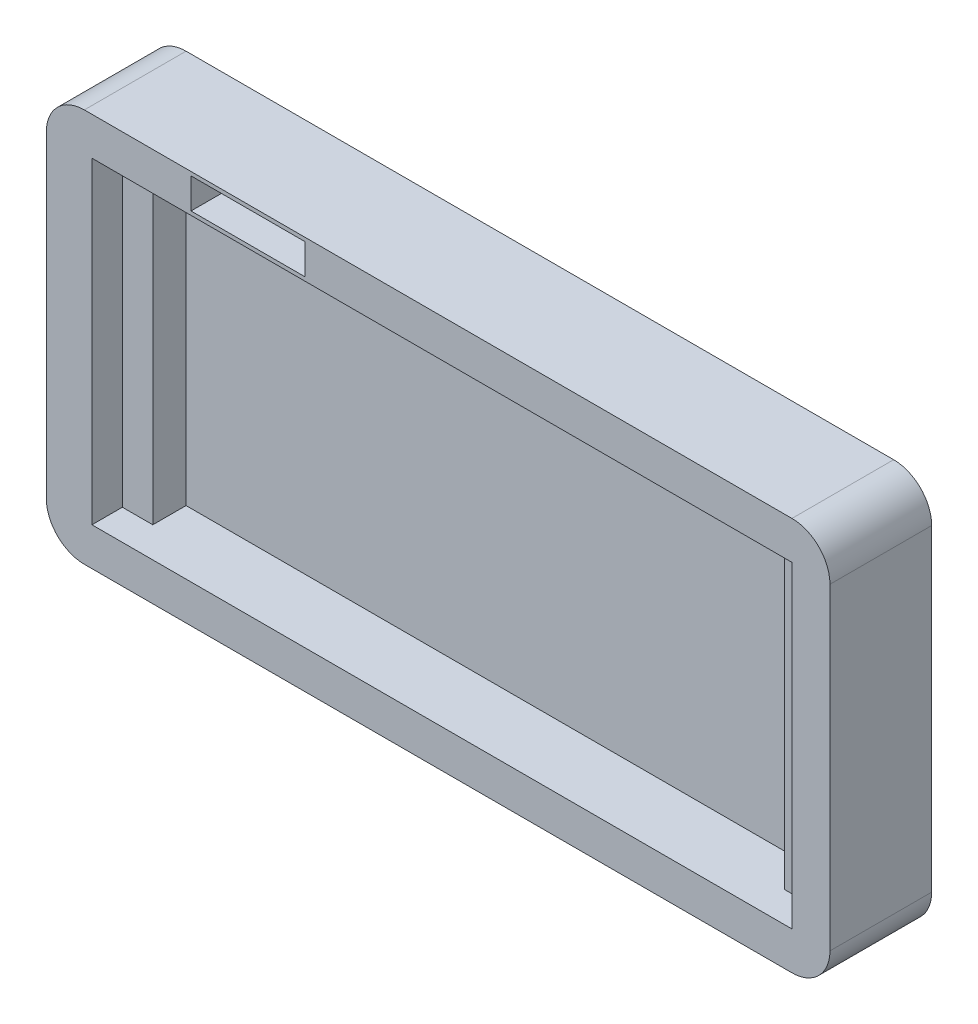
from build123d import *

# Parameters (mm, degrees)
CROQUIS1_W              = 37.22
CROQUIS1_H              = 16.7
SALIENTE_EXTRUIR1_DEPTH = 3.35
VACIADO1_T              = 2
REDONDEO1_R             = 2
CROQUIS2_W              = 2
CROQUIS2_H              = 16.7
SALIENTE_EXTRUIR2_DEPTH = 1.75
CROQUIS6_W              = 0.4
CROQUIS6_H              = 16.7
SALIENTE_EXTRUIR5_DEPTH = 1.6
CROQUIS7_W              = 6
CROQUIS7_H              = 1.6
CORTAR_EXTRUIR1_DEPTH   = 3
CROQUIS10_W             = 8
CROQUIS10_H             = 1.6
CORTAR_EXTRUIR2_DEPTH   = 3


with BuildPart() as part:
    # Croquis1 → Saliente-Extruir1 (new body)
    with BuildSketch(Plane.XY):
        with Locations((18.552250715, 20.301071835)):
            Rectangle(CROQUIS1_W, CROQUIS1_H)
    extrude(amount=SALIENTE_EXTRUIR1_DEPTH)

    # Vaciado1
    vaciado1_openings = [part.faces().sort_by_distance(p)[0] for p in [
        (18.552250715, 20.301071835, 3.35),
    ]]
    offset(amount=VACIADO1_T, openings=vaciado1_openings, kind=Kind.INTERSECTION)

    # Redondeo1
    # the kernel refuses this fillet: 2 mm, written as the material it takes off along each edge
    with BuildSketch(Plane(origin=(-2.057749285, 30.651071835, -7), x_dir=(1, 0, 0), z_dir=(0, 0, 1)), Plane(origin=(39.162250715, 30.651071835, 8.35), x_dir=(-1, 0, 0), z_dir=(0, 0, -1)), Plane(origin=(39.162250715, 9.951071835, 8.35), x_dir=(0, 1, 0), z_dir=(0, 0, -1)), Plane(origin=(-2.057749285, 9.951071835, 8.35), x_dir=(1, 0, 0), z_dir=(0, 0, -1))) as redondeo1_piece_1:
        with BuildLine():
            CenterArc((REDONDEO1_R, -REDONDEO1_R), REDONDEO1_R, 90, 90)
            Line((0, -REDONDEO1_R), (0, 0))
            Line((0, 0), (REDONDEO1_R, 0))
        make_face()
    extrude(amount=15.35, mode=Mode.SUBTRACT)

    # Croquis2 → Saliente-Extruir2 (add)
    with BuildSketch(Plane.XY):
        with Locations((0.942250715, 20.301071835)):
            Rectangle(CROQUIS2_W, CROQUIS2_H)
        with Locations((36.162250715, 20.301071835)):
            Rectangle(CROQUIS2_W, CROQUIS2_H)
    extrude(amount=SALIENTE_EXTRUIR2_DEPTH)

    # Croquis6 → Saliente-Extruir5 (add)
    with BuildSketch(Plane.XY.offset(1.75)):
        with Locations((0.142250715, 20.301071835)):
            Rectangle(CROQUIS6_W, CROQUIS6_H)
    extrude(amount=SALIENTE_EXTRUIR5_DEPTH)

    # Croquis7 → Cortar-Extruir1 (cut)
    with BuildSketch(Plane.XY.offset(3.35)):
        with Locations((8.552250715, 29.651071835)):
            Rectangle(CROQUIS7_W, CROQUIS7_H)
    extrude(amount=-CORTAR_EXTRUIR1_DEPTH, mode=Mode.SUBTRACT)

    # Croquis10 → Cortar-Extruir2 (cut)
    with BuildSketch(Plane.XY.offset(0.35)):
        with Locations((8.552250715, 29.651071835)):
            Rectangle(CROQUIS10_W, CROQUIS10_H)
    extrude(amount=-CORTAR_EXTRUIR2_DEPTH, mode=Mode.SUBTRACT)


solid = part.part
